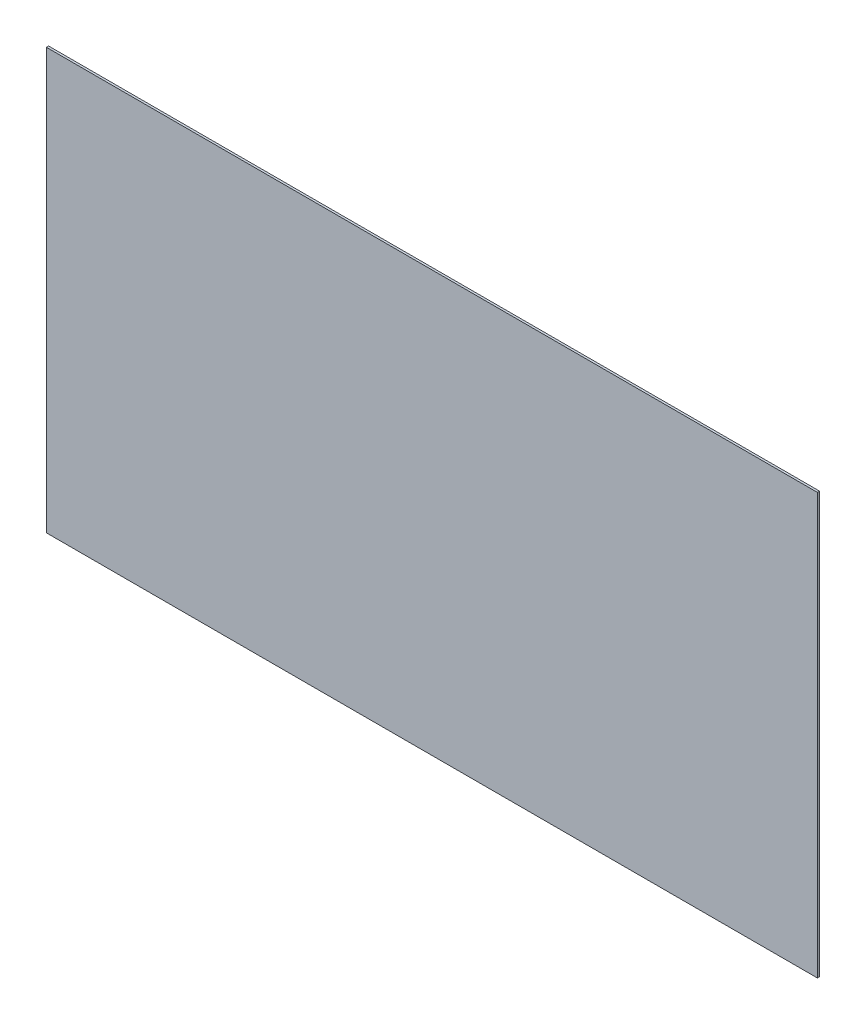
from build123d import *

# Parameters (mm, degrees)
SKETCH1_W           = 1117.6
SKETCH1_H           = 609.6
BOSS_EXTRUDE1_DEPTH = 3.175


with BuildPart() as part:
    # Sketch1 → Boss-Extrude1 (new body)
    with BuildSketch(Plane.XY):
        with Locations((558.8, 304.8)):
            Rectangle(SKETCH1_W, SKETCH1_H)
    extrude(amount=BOSS_EXTRUDE1_DEPTH)


solid = part.part
